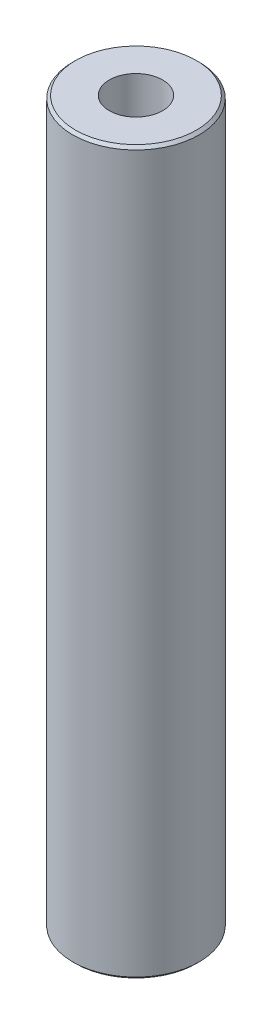
from build123d import *

# Parameters (mm, degrees)
SKETCH1_R           = 52.5
BOSS_EXTRUDE1_DEPTH = 600
SKETCH2_R           = 22.185130788
CUT_EXTRUDE1_DEPTH  = 605.576297914
CHAMFER1_SIZE       = 2.28371574


with BuildPart() as part:
    # Sketch1 → Boss-Extrude1 (new body)
    with BuildSketch(Plane(origin=(0, 0, 0), x_dir=(1, 0, 0), z_dir=(0, 1, 0))):
        Circle(SKETCH1_R)
    extrude(amount=BOSS_EXTRUDE1_DEPTH)

    # Sketch2 → Cut-Extrude1 (cut, through all)
    with BuildSketch(Plane(origin=(0, 0, 0), x_dir=(1, 0, 0), z_dir=(0, 1, 0))):
        Circle(SKETCH2_R)
    extrude(amount=CUT_EXTRUDE1_DEPTH, mode=Mode.SUBTRACT)

    # Chamfer1
    chamfer1_edges = [part.edges().sort_by_distance(p)[0] for p in [
        (-52.5, 600, 0),
        (-52.5, 0, 0),
    ]]
    chamfer(chamfer1_edges, length=CHAMFER1_SIZE)


solid = part.part
